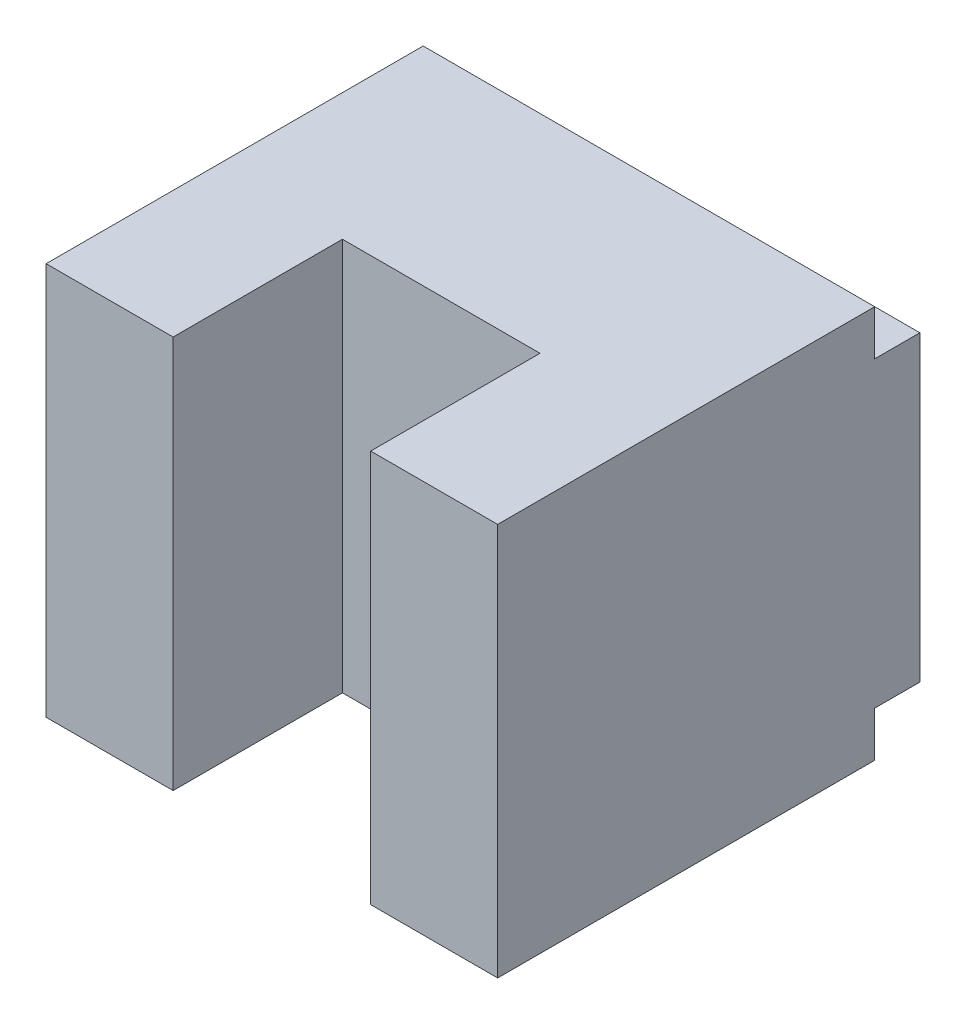
from build123d import *

# Parameters (mm, degrees)
SKETCH1_W               = 25.4
SKETCH1_H               = 22.098
SKETCH1_R               = 3.175
BOSS_EXTRUDE1_DEPTH     = 23.749
SKETCH2_W               = 11.1125
SKETCH2_H               = 22.098
CUT_EXTRUDE1_DEPTH      = 9.525
CUT_EXTRUDE2_DEPTH      = 30.109884953
CUT_EXTRUDE2_DEPTH_BACK = 30.109884953
SKETCH3_W               = 2.54
SKETCH3_H               = 2.54


with BuildPart() as part:
    # Sketch1 → Boss-Extrude1 (new body)
    with BuildSketch(Plane.XY):
        Rectangle(SKETCH1_W, SKETCH1_H)
        Circle(SKETCH1_R, mode=Mode.SUBTRACT)
    extrude(amount=BOSS_EXTRUDE1_DEPTH)

    # Sketch2 → Cut-Extrude1 (cut)
    with BuildSketch(Plane.XY.offset(23.749)):
        Rectangle(SKETCH2_W, SKETCH2_H)
    extrude(amount=-CUT_EXTRUDE1_DEPTH, mode=Mode.SUBTRACT)

    # Sketch3 → Cut-Extrude2 (cut, two sides: drawn at the far end of the back side and taken through both)
    with BuildSketch(Plane(origin=(0, 0, 0), x_dir=(0, 0, -1), z_dir=(1, 0, 0)).offset(-CUT_EXTRUDE2_DEPTH_BACK)):
        with Locations((-1.27, 9.779)):
            Rectangle(SKETCH3_W, SKETCH3_H)
        with Locations((-1.27, -9.779)):
            Rectangle(SKETCH3_W, SKETCH3_H)
    extrude(amount=CUT_EXTRUDE2_DEPTH + CUT_EXTRUDE2_DEPTH_BACK, mode=Mode.SUBTRACT)


solid = part.part
